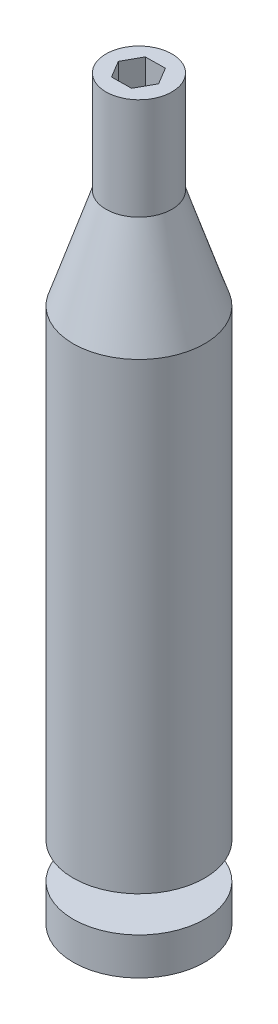
from build123d import *

# Parameters (mm, degrees)
CUT_EXTRUDE1_DEPTH = 10


# Read off the part's stored shape, not the designer's step: Revolve1
with BuildPart() as part:
    # Revolve1 outline → Revolve1 (revolve)
    with BuildSketch(Plane(origin=(-35.161827578, 0, 0), x_dir=(1, 0, 0), z_dir=(0, 0, 1))):
        Polygon((1.297264634, -70.345356918), (0, -70.345356918), (0, -119.615434084), (10.937375972, -119.615434084), (10.937375972, -113.408967551), (2.013315504, -113.408967551), (2.013315504, -75.528254618), (6.68680257, -71.855437745), align=None)
        Polygon((0, 3.056095738), (0, -68.992528566), (8.209241058, -68.992528566), (8.209241058, -74.711892348), (5.481106144, -74.711892348), (5.481106144, -107.485093425), (10.937375972, -107.485093425), (10.937375972, -30.499963707), (5.481106144, -13.85834073), (5.481106144, 3.056095738), align=None)
    revolve(axis=Axis((-35.161827578, 0, 0), (0, 1, 0)))

    # Sketch2 → Cut-Extrude1 (cut)
    with BuildSketch(Plane(origin=(0, 3.056095738, 0), x_dir=(1, 0, 0), z_dir=(0, 1, 0))):
        Polygon((-33.555887845, -2.828831335), (-31.951942031, 0.050715693), (-33.643730001, 2.879547028), (-36.939463785, 2.828831335), (-38.543409599, -0.050715693), (-36.851621629, -2.879547028), align=None)
    extrude(amount=-CUT_EXTRUDE1_DEPTH, mode=Mode.SUBTRACT)


solid = part.part
